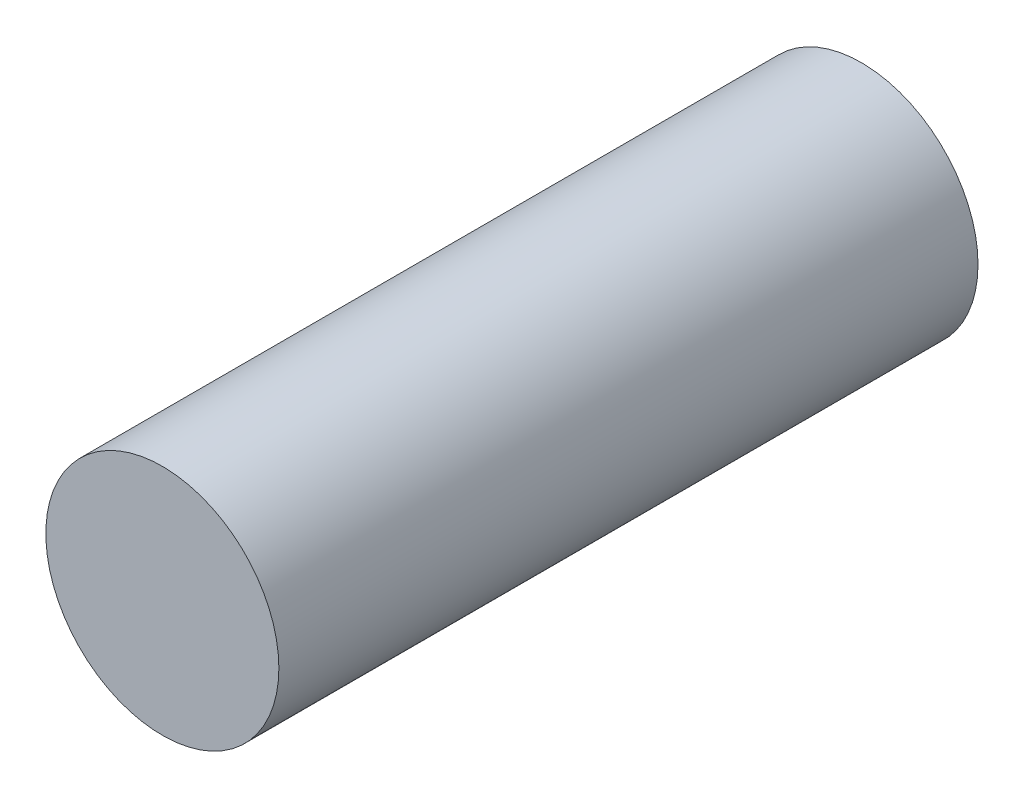
from build123d import *

# Parameters (mm, degrees)
SKETCH1_R           = 5
BOSS_EXTRUDE1_DEPTH = 30
CUT_EXTRUDE1_DEPTH  = 20


with BuildPart() as part:
    # Sketch1 → Boss-Extrude1 (new body)
    with BuildSketch(Plane.XY):
        Circle(SKETCH1_R)
    extrude(amount=BOSS_EXTRUDE1_DEPTH)

    # Sketch2 → Cut-Extrude1 (cut)
    with BuildSketch(Plane(origin=(0, 0, 0), x_dir=(-1, 0, 0), z_dir=(0, 0, -1))):
        with BuildLine():
            Line((-0.5, -1.414213562), (-0.5, -2.514037514))
            Line((-0.5, -2.514037514), (0.5, -2.514037514))
            Line((0.5, -2.514037514), (0.5, -1.414213562))
            ThreePointArc((0.5, -1.414213562), (0, 1.5), (-0.5, -1.414213562))
        make_face()
    extrude(amount=-CUT_EXTRUDE1_DEPTH, mode=Mode.SUBTRACT)


solid = part.part
